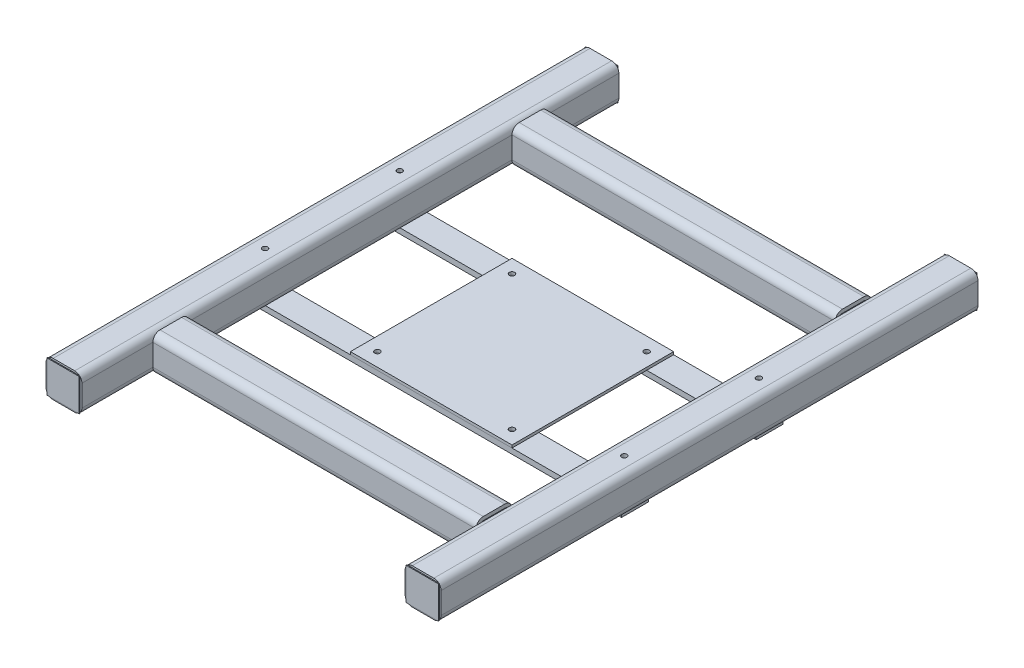
from build123d import *

# Parameters (mm, degrees)
SQUARE_TUBE_20_X_20_X_2_3_DEPTH      = 201
SQUARE_TUBE_20_X_20_X_2_3_DEPTH_BACK = 1
SQUARE_TUBE_20_X_20_X_2_3_2_DEPTH    = 202
SQUARE_TUBE_20_X_20_X_2_3_3_DEPTH    = 300
SQUARE_TUBE_20_X_20_X_2_3_4_DEPTH    = 300
END_START                            = -109
END_CAP1_OUTLINE_W                   = 18
END_CAP1_OUTLINE_H                   = 0.5
END_CAP1_DEPTH                       = 18
END_START_2                          = 91
END_CAP1_2_OUTLINE_W                 = 18
END_CAP1_2_OUTLINE_H                 = 0.5
END_CAP1_2_DEPTH                     = 18
END_START_3                          = -9
END_CAP1_3_OUTLINE_W                 = 18
END_CAP1_3_OUTLINE_H                 = 0.5
END_CAP1_3_DEPTH                     = 18
END_CAP1_4_OUTLINE_W                 = 18
END_CAP1_4_OUTLINE_H                 = 0.5
END_CAP1_4_DEPTH                     = 18
END_START_4                          = -150
END_CAP1_5_DEPTH                     = 0.5
END_START_5                          = 149.5
END_CAP1_6_DEPTH                     = 0.5
END_CAP1_7_DEPTH                     = 0.5
END_CAP1_8_DEPTH                     = 0.5
SKETCH16_W                           = 212
SKETCH16_H                           = 15
BOSS_EXTRUDE4_DEPTH                  = 3
BOSS_EXTRUDE4_2_DEPTH                = 3
SKETCH17_R                           = 1.5
CUT_EXTRUDE1_DEPTH                   = 188.427319247
SKETCH18_W                           = 90
SKETCH18_H                           = 90
BOSS_EXTRUDE5_DEPTH                  = 1.5
SKETCH19_R                           = 1.5
CUT_EXTRUDE2_DEPTH                   = 187.928462252


# Read off the part's stored shape, not the designer's step: End cap1
with BuildPart() as part:
    # Sketch1 → Square tube 20 X 20 X 2(3) (new, two sides: drawn at the far end of the back side and taken through both)
    with BuildSketch(Plane(origin=(-100, 0, 100), x_dir=(0, 0, -1), z_dir=(1, 0, 0)).offset(-SQUARE_TUBE_20_X_20_X_2_3_DEPTH_BACK)):
        with BuildLine():
            Line((-6, -10), (6, -10))
            ThreePointArc((6, -10), (8.828427125, -8.828427125), (10, -6))
            Line((10, -6), (10, 6))
            ThreePointArc((10, 6), (8.828427125, 8.828427125), (6, 10))
            Line((6, 10), (-6, 10))
            ThreePointArc((-6, 10), (-8.828427125, 8.828427125), (-10, 6))
            Line((-10, 6), (-10, -6))
            ThreePointArc((-10, -6), (-8.828427125, -8.828427125), (-6, -10))
        make_face()
        with BuildLine():
            Line((-6, -8), (6, -8))
            ThreePointArc((6, -8), (7.414213562, -7.414213562), (8, -6))
            Line((8, -6), (8, 6))
            ThreePointArc((8, 6), (7.414213562, 7.414213562), (6, 8))
            Line((6, 8), (-6, 8))
            ThreePointArc((-6, 8), (-7.414213562, 7.414213562), (-8, 6))
            Line((-8, 6), (-8, -6))
            ThreePointArc((-8, -6), (-7.414213562, -7.414213562), (-6, -8))
        make_face(mode=Mode.SUBTRACT)
    extrude(amount=SQUARE_TUBE_20_X_20_X_2_3_DEPTH + SQUARE_TUBE_20_X_20_X_2_3_DEPTH_BACK)

    # Square tube 20 X 20 X 2(3) end butt 1
    split(bisect_by=Plane(origin=(-90, 0, 100), x_dir=(0, 1, 0), z_dir=(1, 0, 0)), keep=Keep.TOP)

    # Square tube 20 X 20 X 2(3) end butt 2
    split(bisect_by=Plane(origin=(90, 0, 100), x_dir=(0, -1, 0), z_dir=(-1, 0, 0)), keep=Keep.TOP)


with BuildPart() as body_2:
    # Sketch1 on segment 2 (carried to segment 2) → Square tube 20 X 20 X 2_3 2 (new body)
    with BuildSketch(Plane(origin=(-101, 0, -100), x_dir=(0, 0, -1), z_dir=(1, 0, 0))):
        with BuildLine():
            Line((-6, -10), (6, -10))
            ThreePointArc((6, -10), (8.828427125, -8.828427125), (10, -6))
            Line((10, -6), (10, 6))
            ThreePointArc((10, 6), (8.828427125, 8.828427125), (6, 10))
            Line((6, 10), (-6, 10))
            ThreePointArc((-6, 10), (-8.828427125, 8.828427125), (-10, 6))
            Line((-10, 6), (-10, -6))
            ThreePointArc((-10, -6), (-8.828427125, -8.828427125), (-6, -10))
        make_face()
        with BuildLine():
            Line((-6, -8), (6, -8))
            ThreePointArc((6, -8), (7.414213562, -7.414213562), (8, -6))
            Line((8, -6), (8, 6))
            ThreePointArc((8, 6), (7.414213562, 7.414213562), (6, 8))
            Line((6, 8), (-6, 8))
            ThreePointArc((-6, 8), (-7.414213562, 7.414213562), (-8, 6))
            Line((-8, 6), (-8, -6))
            ThreePointArc((-8, -6), (-7.414213562, -7.414213562), (-6, -8))
        make_face(mode=Mode.SUBTRACT)
    extrude(amount=SQUARE_TUBE_20_X_20_X_2_3_2_DEPTH)

    # Square tube 20 X 20 X 2_3 2 end butt 1
    split(bisect_by=Plane(origin=(-90, 0, -100), x_dir=(0, 1, 0), z_dir=(1, 0, 0)), keep=Keep.TOP)

    # Square tube 20 X 20 X 2_3 2 end butt 2
    split(bisect_by=Plane(origin=(90, 0, -100), x_dir=(0, -1, 0), z_dir=(-1, 0, 0)), keep=Keep.TOP)


with BuildPart() as body_3:
    # Sketch1 on segment 3 (carried to segment 3) → Square tube 20 X 20 X 2_3 3 (new body)
    with BuildSketch(Plane(origin=(100, 0, 150), x_dir=(-1, 0, 0), z_dir=(0, 0, -1))):
        with BuildLine():
            Line((-6, -10), (6, -10))
            ThreePointArc((6, -10), (8.828427125, -8.828427125), (10, -6))
            Line((10, -6), (10, 6))
            ThreePointArc((10, 6), (8.828427125, 8.828427125), (6, 10))
            Line((6, 10), (-6, 10))
            ThreePointArc((-6, 10), (-8.828427125, 8.828427125), (-10, 6))
            Line((-10, 6), (-10, -6))
            ThreePointArc((-10, -6), (-8.828427125, -8.828427125), (-6, -10))
        make_face()
        with BuildLine():
            Line((-6, -8), (6, -8))
            ThreePointArc((6, -8), (7.414213562, -7.414213562), (8, -6))
            Line((8, -6), (8, 6))
            ThreePointArc((8, 6), (7.414213562, 7.414213562), (6, 8))
            Line((6, 8), (-6, 8))
            ThreePointArc((-6, 8), (-7.414213562, 7.414213562), (-8, 6))
            Line((-8, 6), (-8, -6))
            ThreePointArc((-8, -6), (-7.414213562, -7.414213562), (-6, -8))
        make_face(mode=Mode.SUBTRACT)
    extrude(amount=SQUARE_TUBE_20_X_20_X_2_3_3_DEPTH)

    # End cap1 7 outline → End cap1 7 (cut)
    with BuildSketch(Plane.XY.offset(END_START_4)):
        with BuildLine():
            Line((94, -10), (106, -10))
            ThreePointArc((106, -10), (108.828427125, -8.828427125), (110, -6))
            Line((110, -6), (110, 6))
            ThreePointArc((110, 6), (108.828427125, 8.828427125), (106, 10))
            Line((106, 10), (94, 10))
            ThreePointArc((94, 10), (91.171572875, 8.828427125), (90, 6))
            Line((90, 6), (90, -6))
            ThreePointArc((90, -6), (91.171572875, -8.828427125), (94, -10))
        make_face()
        with BuildLine():
            ThreePointArc((94, -8), (92.585786438, -7.414213562), (92, -6))
            Line((92, -6), (92, 6))
            ThreePointArc((92, 6), (92.585786438, 7.414213562), (94, 8))
            Line((94, 8), (106, 8))
            ThreePointArc((106, 8), (107.414213562, 7.414213562), (108, 6))
            Line((108, 6), (108, -6))
            ThreePointArc((108, -6), (107.414213562, -7.414213562), (106, -8))
            Line((106, -8), (94, -8))
        make_face(mode=Mode.SUBTRACT)
    extrude(amount=END_CAP1_7_DEPTH, mode=Mode.SUBTRACT)

    # End cap1 8 outline → End cap1 8 (cut)
    with BuildSketch(Plane.XY.offset(END_START_5)):
        with BuildLine():
            Line((94, -10), (106, -10))
            ThreePointArc((106, -10), (108.828427125, -8.828427125), (110, -6))
            Line((110, -6), (110, 6))
            ThreePointArc((110, 6), (108.828427125, 8.828427125), (106, 10))
            Line((106, 10), (94, 10))
            ThreePointArc((94, 10), (91.171572875, 8.828427125), (90, 6))
            Line((90, 6), (90, -6))
            ThreePointArc((90, -6), (91.171572875, -8.828427125), (94, -10))
        make_face()
        with BuildLine():
            ThreePointArc((94, -8), (92.585786438, -7.414213562), (92, -6))
            Line((92, -6), (92, 6))
            ThreePointArc((92, 6), (92.585786438, 7.414213562), (94, 8))
            Line((94, 8), (106, 8))
            ThreePointArc((106, 8), (107.414213562, 7.414213562), (108, 6))
            Line((108, 6), (108, -6))
            ThreePointArc((108, -6), (107.414213562, -7.414213562), (106, -8))
            Line((106, -8), (94, -8))
        make_face(mode=Mode.SUBTRACT)
    extrude(amount=END_CAP1_8_DEPTH, mode=Mode.SUBTRACT)


with BuildPart() as body_4:
    # Sketch1 on segment 4 (carried to segment 4) → Square tube 20 X 20 X 2_3 4 (new body)
    with BuildSketch(Plane(origin=(-100, 0, 150), x_dir=(-1, 0, 0), z_dir=(0, 0, -1))):
        with BuildLine():
            Line((-6, -10), (6, -10))
            ThreePointArc((6, -10), (8.828427125, -8.828427125), (10, -6))
            Line((10, -6), (10, 6))
            ThreePointArc((10, 6), (8.828427125, 8.828427125), (6, 10))
            Line((6, 10), (-6, 10))
            ThreePointArc((-6, 10), (-8.828427125, 8.828427125), (-10, 6))
            Line((-10, 6), (-10, -6))
            ThreePointArc((-10, -6), (-8.828427125, -8.828427125), (-6, -10))
        make_face()
        with BuildLine():
            Line((-6, -8), (6, -8))
            ThreePointArc((6, -8), (7.414213562, -7.414213562), (8, -6))
            Line((8, -6), (8, 6))
            ThreePointArc((8, 6), (7.414213562, 7.414213562), (6, 8))
            Line((6, 8), (-6, 8))
            ThreePointArc((-6, 8), (-7.414213562, 7.414213562), (-8, 6))
            Line((-8, 6), (-8, -6))
            ThreePointArc((-8, -6), (-7.414213562, -7.414213562), (-6, -8))
        make_face(mode=Mode.SUBTRACT)
    extrude(amount=SQUARE_TUBE_20_X_20_X_2_3_4_DEPTH)

    # End cap1 5 outline → End cap1 5 (cut)
    with BuildSketch(Plane.XY.offset(END_START_4)):
        with BuildLine():
            Line((-106, -10), (-94, -10))
            ThreePointArc((-94, -10), (-91.171572875, -8.828427125), (-90, -6))
            Line((-90, -6), (-90, 6))
            ThreePointArc((-90, 6), (-91.171572875, 8.828427125), (-94, 10))
            Line((-94, 10), (-106, 10))
            ThreePointArc((-106, 10), (-108.828427125, 8.828427125), (-110, 6))
            Line((-110, 6), (-110, -6))
            ThreePointArc((-110, -6), (-108.828427125, -8.828427125), (-106, -10))
        make_face()
        with BuildLine():
            ThreePointArc((-106, -8), (-107.414213562, -7.414213562), (-108, -6))
            Line((-108, -6), (-108, 6))
            ThreePointArc((-108, 6), (-107.414213562, 7.414213562), (-106, 8))
            Line((-106, 8), (-94, 8))
            ThreePointArc((-94, 8), (-92.585786438, 7.414213562), (-92, 6))
            Line((-92, 6), (-92, -6))
            ThreePointArc((-92, -6), (-92.585786438, -7.414213562), (-94, -8))
            Line((-94, -8), (-106, -8))
        make_face(mode=Mode.SUBTRACT)
    extrude(amount=END_CAP1_5_DEPTH, mode=Mode.SUBTRACT)

    # End cap1 6 outline → End cap1 6 (cut)
    with BuildSketch(Plane.XY.offset(END_START_5)):
        with BuildLine():
            Line((-106, -10), (-94, -10))
            ThreePointArc((-94, -10), (-91.171572875, -8.828427125), (-90, -6))
            Line((-90, -6), (-90, 6))
            ThreePointArc((-90, 6), (-91.171572875, 8.828427125), (-94, 10))
            Line((-94, 10), (-106, 10))
            ThreePointArc((-106, 10), (-108.828427125, 8.828427125), (-110, 6))
            Line((-110, 6), (-110, -6))
            ThreePointArc((-110, -6), (-108.828427125, -8.828427125), (-106, -10))
        make_face()
        with BuildLine():
            ThreePointArc((-106, -8), (-107.414213562, -7.414213562), (-108, -6))
            Line((-108, -6), (-108, 6))
            ThreePointArc((-108, 6), (-107.414213562, 7.414213562), (-106, 8))
            Line((-106, 8), (-94, 8))
            ThreePointArc((-94, 8), (-92.585786438, 7.414213562), (-92, 6))
            Line((-92, 6), (-92, -6))
            ThreePointArc((-92, -6), (-92.585786438, -7.414213562), (-94, -8))
            Line((-94, -8), (-106, -8))
        make_face(mode=Mode.SUBTRACT)
    extrude(amount=END_CAP1_6_DEPTH, mode=Mode.SUBTRACT)


with BuildPart() as body_5:
    # End cap1 outline → End cap1 (new body)
    with BuildSketch(Plane.YZ.offset(END_START)):
        with Locations((0, -149.75)):
            Rectangle(END_CAP1_OUTLINE_W, END_CAP1_OUTLINE_H)
    extrude(amount=END_CAP1_DEPTH)


with BuildPart() as body_6:
    # End cap1 2 outline → End cap1 2 (new body)
    with BuildSketch(Plane.YZ.offset(END_START_2)):
        with Locations((0, -149.75)):
            Rectangle(END_CAP1_2_OUTLINE_W, END_CAP1_2_OUTLINE_H)
    extrude(amount=END_CAP1_2_DEPTH)


with BuildPart() as body_7:
    # End cap1 3 outline → End cap1 3 (new body)
    with BuildSketch(Plane(origin=(0, 0, 0), x_dir=(1, 0, 0), z_dir=(0, 1, 0)).offset(END_START_3)):
        with Locations((-100, -149.75)):
            Rectangle(END_CAP1_3_OUTLINE_W, END_CAP1_3_OUTLINE_H)
    extrude(amount=END_CAP1_3_DEPTH)


with BuildPart() as body_8:
    # End cap1 4 outline → End cap1 4 (new body)
    with BuildSketch(Plane(origin=(0, 0, 0), x_dir=(1, 0, 0), z_dir=(0, 1, 0)).offset(END_START_3)):
        with Locations((100, -149.75)):
            Rectangle(END_CAP1_4_OUTLINE_W, END_CAP1_4_OUTLINE_H)
    extrude(amount=END_CAP1_4_DEPTH)


with BuildPart() as body_9:
    # Sketch16 → Boss-Extrude4 (new body)
    with BuildSketch(Plane.XZ.offset(10)):
        with Locations((0, 37.5)):
            Rectangle(SKETCH16_W, SKETCH16_H)
    extrude(amount=BOSS_EXTRUDE4_DEPTH)


with BuildPart() as body_10:
    # Sketch16 → Boss-Extrude4 2 (new body)
    with BuildSketch(Plane.XZ.offset(10)):
        with Locations((0, -37.5)):
            Rectangle(SKETCH16_W, SKETCH16_H)
    extrude(amount=BOSS_EXTRUDE4_2_DEPTH)


with BuildPart() as cut_extrude1_tool:
    # Sketch17 → Cut-Extrude1 (new, through all)
    with BuildSketch(Plane.XZ.offset(13)):
        with Locations(Location((-100, 37.5, 0), (0, 0, 270))):
            Circle(SKETCH17_R)
        with Locations(Location((-100, -37.5, 0), (0, 0, 90))):
            Circle(SKETCH17_R)
        with Locations(Location((100, -37.5, 0), (0, 0, 270))):
            Circle(SKETCH17_R)
        with Locations(Location((100, 37.5, 0), (0, 0, 270))):
            Circle(SKETCH17_R)
    extrude(amount=-CUT_EXTRUDE1_DEPTH)


with BuildPart() as body_3_1:
    add(body_3.part)

    # Cut-Extrude1: cut by cut_extrude1_tool
    add(cut_extrude1_tool.part, mode=Mode.SUBTRACT)


with BuildPart() as body_4_1:
    add(body_4.part)

    # Cut-Extrude1: cut by cut_extrude1_tool
    add(cut_extrude1_tool.part, mode=Mode.SUBTRACT)


with BuildPart() as body_9_1:
    add(body_9.part)

    # Cut-Extrude1: cut by cut_extrude1_tool
    add(cut_extrude1_tool.part, mode=Mode.SUBTRACT)


with BuildPart() as body_10_1:
    add(body_10.part)

    # Cut-Extrude1: cut by cut_extrude1_tool
    add(cut_extrude1_tool.part, mode=Mode.SUBTRACT)


with BuildPart() as body_11:
    # Sketch18 → Boss-Extrude5 (new body)
    with BuildSketch(Plane(origin=(0, -10, 0), x_dir=(1, 0, 0), z_dir=(0, 1, 0))):
        Rectangle(SKETCH18_W, SKETCH18_H)
    extrude(amount=BOSS_EXTRUDE5_DEPTH)


with BuildPart() as cut_extrude2_tool:
    # Sketch19 → Cut-Extrude2 (new, through all)
    with BuildSketch(Plane(origin=(0, -8.5, 0), x_dir=(1, 0, 0), z_dir=(0, 1, 0))):
        with Locations(Location((37.5, -37.5, 0), (0, 0, 270))):
            Circle(SKETCH19_R)
        with Locations(Location((-37.5, -37.5, 0), (0, 0, 270))):
            Circle(SKETCH19_R)
        with Locations(Location((37.5, 37.5, 0), (0, 0, 270))):
            Circle(SKETCH19_R)
        with Locations(Location((-37.5, 37.5, 0), (0, 0, 270))):
            Circle(SKETCH19_R)
    extrude(amount=-CUT_EXTRUDE2_DEPTH)


with BuildPart() as body_9_2:
    add(body_9_1.part)

    # Cut-Extrude2: cut by cut_extrude2_tool
    add(cut_extrude2_tool.part, mode=Mode.SUBTRACT)


with BuildPart() as body_10_2:
    add(body_10_1.part)

    # Cut-Extrude2: cut by cut_extrude2_tool
    add(cut_extrude2_tool.part, mode=Mode.SUBTRACT)


with BuildPart() as body_11_1:
    add(body_11.part)

    # Cut-Extrude2: cut by cut_extrude2_tool
    add(cut_extrude2_tool.part, mode=Mode.SUBTRACT)


solid = Compound([part.part, body_2.part, body_5.part, body_6.part, body_7.part, body_8.part, body_3_1.part, body_4_1.part, body_9_2.part, body_10_2.part, body_11_1.part])
